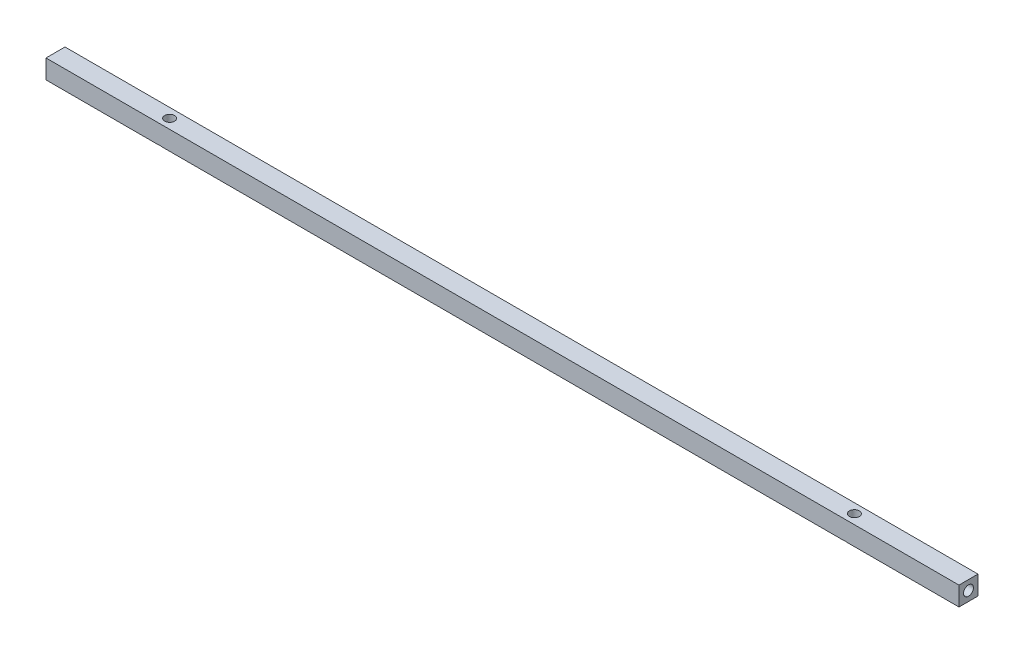
from build123d import *

# Parameters (mm, degrees)
SKETCH1_W                = 6.35
SKETCH1_H                = 6.35
BOSS_EXTRUDE1_DEPTH      = 152.4
SKETCH2_R                = 1.651
CUT_EXTRUDE1_DEPTH       = 19.05
SKETCH3_R                = 1.651
CUT_EXTRUDE2_DEPTH       = 153.565274965
CHAMFER1_SIZE            = 1.5875
CHAMFER1_OF_MIRROR1_SIZE = 1.5875


with BuildPart() as part:
    # Sketch1 → Boss-Extrude1 (new, symmetric)
    with BuildSketch(Plane(origin=(0, 0, 0), x_dir=(0, 0, -1), z_dir=(1, 0, 0))):
        Rectangle(SKETCH1_W, SKETCH1_H)
    extrude(amount=BOSS_EXTRUDE1_DEPTH, both=True)

    # Sketch2 → Cut-Extrude1 (cut)
    with BuildSketch(Plane(origin=(152.4, 0, 0), x_dir=(0, 0, -1), z_dir=(1, 0, 0))):
        Circle(SKETCH2_R)
    cut_extrude1 = extrude(amount=-CUT_EXTRUDE1_DEPTH, mode=Mode.SUBTRACT)

    # Sketch3 → Cut-Extrude2 (cut, through all)
    with BuildSketch(Plane(origin=(0, -3.175, 0), x_dir=(-1, 0, 0), z_dir=(0, -1, 0))):
        with Locations(Location((-114.3, 0, 0), (0, 0, 90))):
            Circle(SKETCH3_R)
    cut_extrude2 = extrude(amount=-CUT_EXTRUDE2_DEPTH, mode=Mode.SUBTRACT)

    # Chamfer1
    # the kernel refuses this chamfer: 1.5875 mm, written as the material it takes off along each edge
    with BuildSketch(Plane(origin=(114.3, -3.175, 0), x_dir=(0, 0, -1), z_dir=(-1, 0, 0))) as chamfer1_piece_1:
        Polygon((1.651 + CHAMFER1_SIZE, 0), (1.651, -CHAMFER1_SIZE), (1.651, 0), align=None)
    revolve(axis=Axis((114.3, -3.175, 0), (0, -1, 0)), mode=Mode.SUBTRACT)

    # Mirror1: Cut-Extrude1, Cut-Extrude2 across plane
    add(cut_extrude1.mirror(Plane(origin=(0, 0, 0), x_dir=(0, 0, 1), z_dir=(1, 0, 0))), mode=Mode.SUBTRACT)
    add(cut_extrude2.mirror(Plane(origin=(0, 0, 0), x_dir=(0, 0, 1), z_dir=(1, 0, 0))), mode=Mode.SUBTRACT)

    # Chamfer1 of Mirror1
    # the kernel refuses this chamfer: 1.5875 mm, written as the material it takes off along each edge
    with BuildSketch(Plane(origin=(-114.3, -3.175, 0), x_dir=(0, 0, -1), z_dir=(1, 0, 0))) as chamfer1_of_mirror1_piece_1:
        Polygon((1.651 + CHAMFER1_OF_MIRROR1_SIZE, 0), (1.651, CHAMFER1_OF_MIRROR1_SIZE), (1.651, 0), align=None)
    revolve(axis=Axis((-114.3, -3.175, 0), (0, 1, 0)), mode=Mode.SUBTRACT)


solid = part.part
